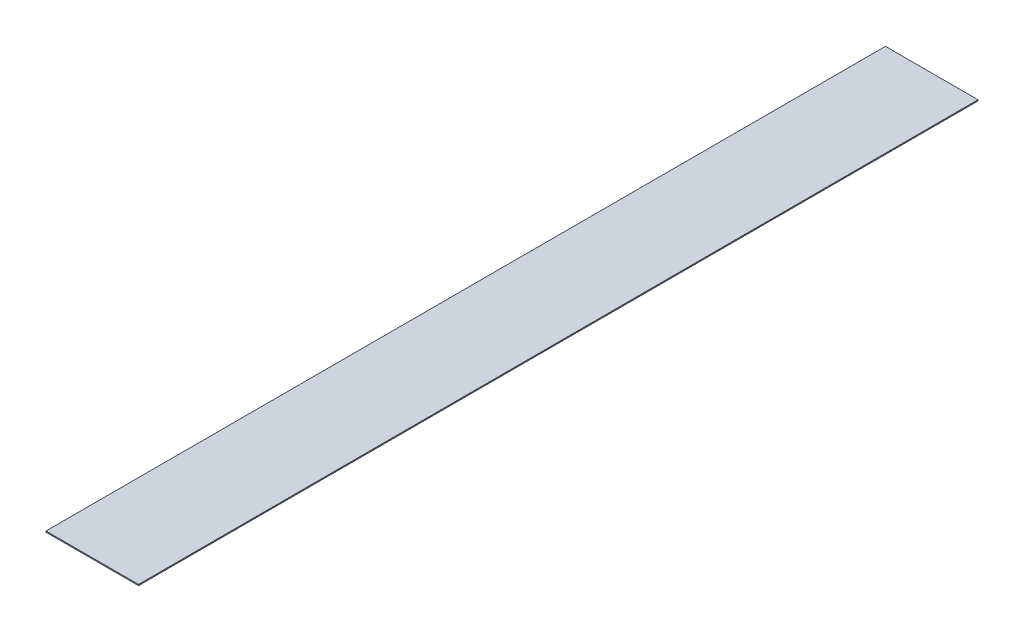
from build123d import *

# Parameters (mm, degrees)
SKETCH2_W           = 4.3
SKETCH2_H           = 39
BOSS_EXTRUDE1_DEPTH = 0.025


with BuildPart() as part:
    # Sketch2 → Boss-Extrude1 (new, symmetric)
    with BuildSketch(Plane(origin=(0, 0, 0), x_dir=(1, 0, 0), z_dir=(0, 1, 0))):
        Rectangle(SKETCH2_W, SKETCH2_H)
    extrude(amount=BOSS_EXTRUDE1_DEPTH, both=True)


solid = part.part
